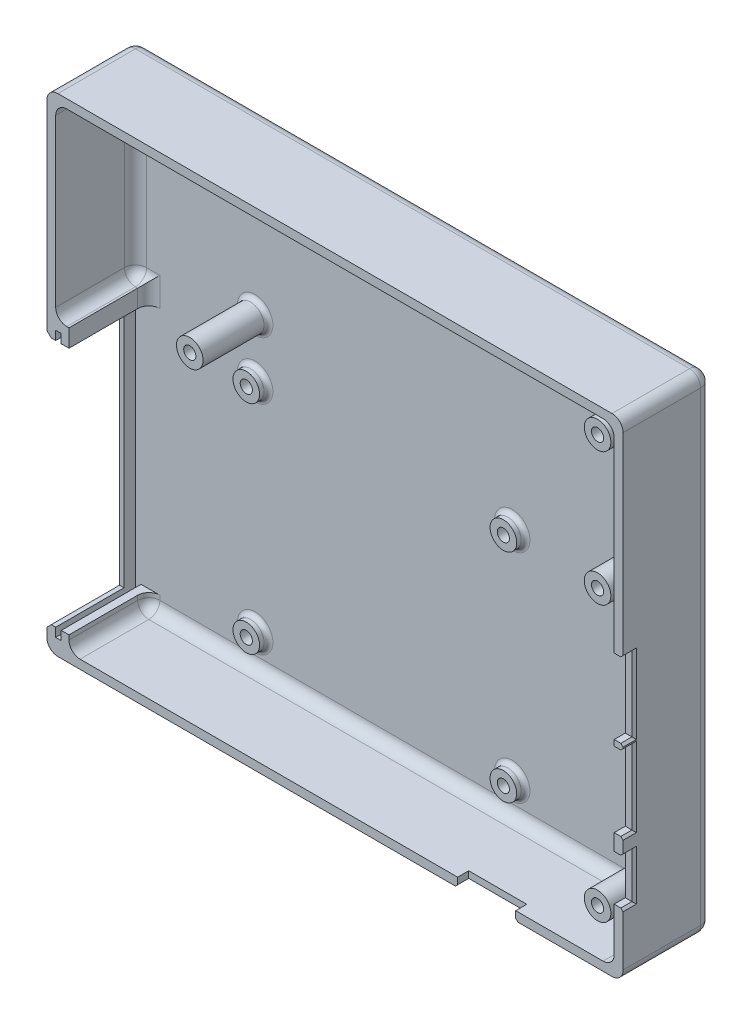
from build123d import *

# Parameters (mm, degrees)
ESQUISSE1_W             = 130
ESQUISSE1_H             = 110
BOSS_EXTRU_1_DEPTH      = 2
ESQUISSE3_R             = 3
ESQUISSE3_R_2           = 1.375
BOSS_EXTRU_2_DEPTH      = 2
ESQUISSE4_R             = 3
ESQUISSE4_R_2           = 1.375
BOSS_EXTRU_3_DEPTH      = 14.75
CONG_1_R                = 1
ESQUISSE5_W             = 130
ESQUISSE5_H             = 110
ESQUISSE5_W_2           = 126
ESQUISSE5_H_2           = 106
BOSS_EXTRU_5_DEPTH      = 18
CONG_3_R                = 2.5
ESQUISSE6_W             = 2
ESQUISSE6_H             = 10.3
ESQUISSE6_H_2           = 16.88
ESQUISSE6_W_2           = 13.1
ESQUISSE6_H_3           = 2
ENL_V_MAT_EXTRU_1_DEPTH = 2.5
ESQUISSE7_W             = 2
ESQUISSE7_H             = 56
ENL_V_MAT_EXTRU_2_DEPTH = 15.4
CONG_5_R                = 2.5
ESQUISSE9_W             = 18
ESQUISSE9_H             = 2
ESQUISSE9_H_2           = 1.5
BOSS_EXTRU_6_DEPTH      = 3
ESQUISSE11_W            = 1.75
ESQUISSE11_H            = 18
BOSS_EXTRU_7_DEPTH      = 2
ESQUISSE12_W            = 1.75
ESQUISSE12_H            = 18
BOSS_EXTRU_8_DEPTH      = 2
CONG_7_R                = 2.5
CONG_8_R                = 2.5
CONG_9_R                = 2.5
CHANFREIN1_SIZE         = 1
CHANFREIN2_SIZE         = 0.5


with BuildPart() as part:
    # Esquisse1 → Boss.-Extru.1 (new body)
    with BuildSketch(Plane.XY):
        with Locations((-22.737274581, 16.021428571)):
            Rectangle(ESQUISSE1_W, ESQUISSE1_H)
    extrude(amount=BOSS_EXTRU_1_DEPTH)

    # Esquisse3 → Boss.-Extru.2 (add)
    # profile 1 of 8: a face of its own
    with BuildSketch(Plane.XY.offset(2)):
        with Locations((-58.737274581, -29.978571429)):
            Circle(ESQUISSE3_R)
        with Locations((-58.737274581, -29.978571429)):
            Circle(ESQUISSE3_R_2, mode=Mode.SUBTRACT)
    # profile 2 of 8: a face of its own
    with BuildSketch(Plane.XY.offset(2)):
        with Locations((-0.737274581, -29.978571429)):
            Circle(ESQUISSE3_R)
        with Locations((-0.737274581, -29.978571429)):
            Circle(ESQUISSE3_R_2, mode=Mode.SUBTRACT)
    # profile 3 of 8: a face of its own
    with BuildSketch(Plane.XY.offset(2)):
        with Locations((33.262725419, -29.978571429)):
            Circle(ESQUISSE3_R)
        with Locations((33.262725419, -29.978571429)):
            Circle(ESQUISSE3_R_2, mode=Mode.SUBTRACT)
    # profile 4 of 8: a face of its own
    with BuildSketch(Plane.XY.offset(2)):
        with Locations((-0.737274581, 19.021428571)):
            Circle(ESQUISSE3_R)
        with Locations((-0.737274581, 19.021428571)):
            Circle(ESQUISSE3_R_2, mode=Mode.SUBTRACT)
    # profile 5 of 8: a face of its own
    with BuildSketch(Plane.XY.offset(2)):
        with Locations((33.262725419, 32.021428571)):
            Circle(ESQUISSE3_R)
        with Locations((33.262725419, 32.021428571)):
            Circle(ESQUISSE3_R_2, mode=Mode.SUBTRACT)
    # profile 6 of 8: a face of its own
    with BuildSketch(Plane.XY.offset(2)):
        with Locations((-58.737274581, 32.021428571)):
            Circle(ESQUISSE3_R)
        with Locations((-58.737274581, 32.021428571)):
            Circle(ESQUISSE3_R_2, mode=Mode.SUBTRACT)
    # profile 7 of 8: a face of its own
    with BuildSketch(Plane.XY.offset(2)):
        with Locations((-58.737274581, 19.021428571)):
            Circle(ESQUISSE3_R)
        with Locations((-58.737274581, 19.021428571)):
            Circle(ESQUISSE3_R_2, mode=Mode.SUBTRACT)
    # profile 8 of 8: a face of its own
    with BuildSketch(Plane.XY.offset(2)):
        with Locations((33.262725419, 62.021428571)):
            Circle(ESQUISSE3_R)
        with Locations((33.262725419, 62.021428571)):
            Circle(ESQUISSE3_R_2, mode=Mode.SUBTRACT)
    extrude(amount=BOSS_EXTRU_2_DEPTH)

    # Esquisse4 → Boss.-Extru.3 (add)
    # profile 1 of 4: a face of its own
    with BuildSketch(Plane.XY.offset(2)):
        with Locations((-58.737274581, 32.021428571)):
            Circle(ESQUISSE4_R)
        with Locations((-58.737274581, 32.021428571)):
            Circle(ESQUISSE4_R_2, mode=Mode.SUBTRACT)
    # profile 2 of 4: a face of its own
    with BuildSketch(Plane.XY.offset(2)):
        with Locations((33.262725419, 62.021428571)):
            Circle(ESQUISSE4_R)
        with Locations((33.262725419, 62.021428571)):
            Circle(ESQUISSE4_R_2, mode=Mode.SUBTRACT)
    # profile 3 of 4: a face of its own
    with BuildSketch(Plane.XY.offset(2)):
        with Locations((33.262725419, 32.021428571)):
            Circle(ESQUISSE4_R)
        with Locations((33.262725419, 32.021428571)):
            Circle(ESQUISSE4_R_2, mode=Mode.SUBTRACT)
    # profile 4 of 4: a face of its own
    with BuildSketch(Plane.XY.offset(2)):
        with Locations((33.262725419, -29.978571429)):
            Circle(ESQUISSE4_R)
        with Locations((33.262725419, -29.978571429)):
            Circle(ESQUISSE4_R_2, mode=Mode.SUBTRACT)
    extrude(amount=BOSS_EXTRU_3_DEPTH)

    # Congé1
    cong_1_edges = [part.edges().sort_by_distance(p)[0] for p in [
        (30.262725419, 62.021428571, 2),
        (30.262725419, 32.021428571, 2),
        (-61.737274581, -29.978571429, 2),
        (30.262725419, -29.978571429, 2),
        (-3.737274581, -29.978571429, 2),
        (-3.737274581, 19.021428571, 2),
        (-61.737274581, 19.021428571, 2),
        (-61.737274581, 32.021428571, 2),
    ]]
    fillet(cong_1_edges, radius=CONG_1_R)

    # Esquisse5 → Boss.-Extru.5 (add)
    with BuildSketch(Plane.XY.offset(2)):
        with Locations((-22.737274581, 16.021428571)):
            Rectangle(ESQUISSE5_W, ESQUISSE5_H)
        with Locations((-22.737274581, 16.021428571)):
            Rectangle(ESQUISSE5_W_2, ESQUISSE5_H_2, mode=Mode.SUBTRACT)
    extrude(amount=BOSS_EXTRU_5_DEPTH)

    # Congé3
    cong_3_edges = [part.edges().sort_by_distance(p)[0] for p in [
        (42.262725419, 71.021428571, 10),
        (42.262725419, -38.978571429, 10),
        (-87.737274581, -38.978571429, 10),
        (-87.737274581, 71.021428571, 10),
    ]]
    fillet(cong_3_edges, radius=CONG_3_R)

    # Esquisse6 → Enlèv. mat.-Extru.1 (cut)
    with BuildSketch(Plane.XY.offset(20)):
        with Locations((41.262725419, -19.438571429)):
            Rectangle(ESQUISSE6_W, ESQUISSE6_H)
        with Locations((41.262725419, -2.168571429)):
            Rectangle(ESQUISSE6_W, ESQUISSE6_H_2)
        with Locations((41.262725419, 16.021428571)):
            Rectangle(ESQUISSE6_W, ESQUISSE6_H_2)
        with Locations((11.492725419, -37.978571429)):
            Rectangle(ESQUISSE6_W_2, ESQUISSE6_H_3)
    extrude(amount=-ENL_V_MAT_EXTRU_1_DEPTH, mode=Mode.SUBTRACT)

    # Esquisse7 → Enlèv. mat.-Extru.2 (cut)
    with BuildSketch(Plane.XY.offset(20)):
        with Locations((-86.737274581, -5.478571429)):
            Rectangle(ESQUISSE7_W, ESQUISSE7_H)
    extrude(amount=-ENL_V_MAT_EXTRU_2_DEPTH, mode=Mode.SUBTRACT)

    # Congé5
    cong_5_edges = [part.edges().sort_by_distance(p)[0] for p in [
        (41.530492372, 70.289195524, 0),
        (42.262725419, 16.021428571, 0),
        (41.530492372, -38.246338382, 0),
        (-22.737274581, -38.978571429, 0),
        (-87.005041533, -38.246338382, 0),
        (-87.737274581, 16.021428571, 0),
        (-87.005041533, 70.289195524, 0),
        (-22.737274581, 71.021428571, 0),
    ]]
    fillet(cong_5_edges, radius=CONG_5_R)

    # Esquisse9 → Boss.-Extru.6 (add)
    with BuildSketch(Plane(origin=(-85.737274581, 0, 0), x_dir=(0, 0, -1), z_dir=(1, 0, 0))):
        with Locations((-11, 25.521428571)):
            Rectangle(ESQUISSE9_W, ESQUISSE9_H)
        with Locations((-11, -36.228571429)):
            Rectangle(ESQUISSE9_W, ESQUISSE9_H_2)
    extrude(amount=BOSS_EXTRU_6_DEPTH)

    # Esquisse11 → Boss.-Extru.7 (add)
    with BuildSketch(Plane.XZ.offset(-24.521428571)):
        with Locations((-83.612274581, 11)):
            Rectangle(ESQUISSE11_W, ESQUISSE11_H)
    extrude(amount=BOSS_EXTRU_7_DEPTH)

    # Esquisse12 → Boss.-Extru.8 (add)
    with BuildSketch(Plane(origin=(0, -35.478571429, 0), x_dir=(1, 0, 0), z_dir=(0, 1, 0))):
        with Locations((-83.612274581, -11)):
            Rectangle(ESQUISSE12_W, ESQUISSE12_H)
    extrude(amount=BOSS_EXTRU_8_DEPTH)

    # Congé7
    cong_7_edges = [part.edges().sort_by_distance(p)[0] for p in [
        (40.262725419, -36.978571429, 11),
        (-82.737274581, -36.978571429, 11),
        (-85.737274581, 26.521428571, 11),
        (-85.737274581, 69.021428571, 11),
        (40.262725419, 69.021428571, 11),
    ]]
    fillet(cong_7_edges, radius=CONG_7_R)

    # Congé8
    cong_8_edges = [part.edges().sort_by_distance(p)[0] for p in [
        (-82.737274581, -33.978571429, 2),
        (-82.005041533, -36.246338382, 2),
        (-21.237274581, -36.978571429, 2),
        (39.530492372, -36.246338382, 2),
        (40.262725419, 16.021428571, 2),
        (39.530492372, 68.289195524, 2),
        (-22.737274581, 69.021428571, 2),
        (-85.005041533, 68.289195524, 2),
        (-82.987274581, 26.521428571, 2),
        (-85.005041533, 27.253661618, 2),
        (-85.737274581, 47.771428571, 2),
    ]]
    fillet(cong_8_edges, radius=CONG_8_R)

    # Congé9
    cong_9_edges = [part.edges().sort_by_distance(p)[0] for p in [
        (-82.737274581, 25.771428571, 2),
    ]]
    fillet(cong_9_edges, radius=CONG_9_R)

    # Chanfrein1
    chanfrein1_edges = [part.edges().sort_by_distance(p)[0] for p in [
        (-87.737274581, -33.478571429, 12.3),
        (-87.737274581, -5.478571429, 4.6),
        (-87.737274581, 22.521428571, 12.3),
    ]]
    chamfer(chanfrein1_edges, length=CHANFREIN1_SIZE)

    # Chanfrein2
    chanfrein2_edges = [part.edges().sort_by_distance(p)[0] for p in [
        (42.262725419, 24.461428571, 18.75),
        (42.262725419, 16.021428571, 17.5),
        (42.262725419, 7.581428571, 18.75),
        (42.262725419, 6.271428571, 18.75),
        (42.262725419, -2.168571429, 17.5),
        (42.262725419, -10.608571429, 18.75),
        (42.262725419, -14.288571429, 18.75),
        (42.262725419, -19.438571429, 17.5),
        (42.262725419, -24.588571429, 18.75),
        (4.942725419, -38.978571429, 18.75),
        (18.042725419, -38.978571429, 18.75),
        (11.492725419, -38.978571429, 17.5),
    ]]
    chamfer(chanfrein2_edges, length=CHANFREIN2_SIZE)


solid = part.part
